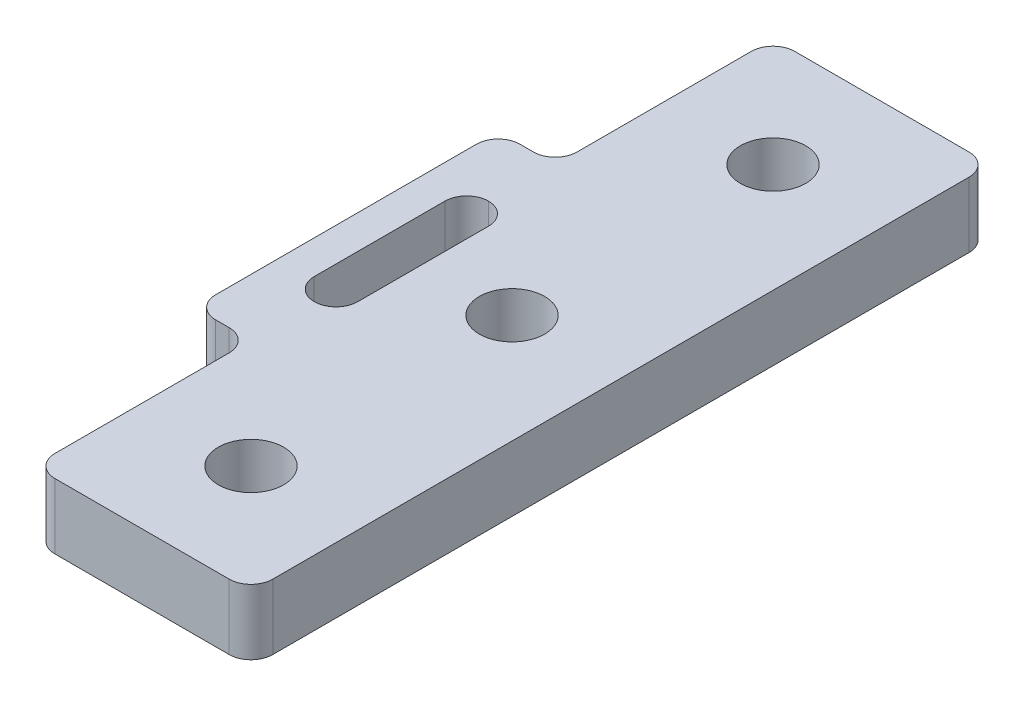
from build123d import *

# Parameters (mm, degrees)
SKETCH2_W           = 10
SKETCH2_H           = 10
SKETCH2_R           = 1.5
SKETCH2_W_2         = 12.62
SKETCH2_H_2         = 13.97
SKETCH2_W_3         = 2
SKETCH2_H_3         = 8
BOSS_EXTRUDE1_DEPTH = 3
FILLET2_R           = 1
FILLET3_R           = 1


with BuildPart() as part:
    # Sketch2 → Boss-Extrude1 (new body)
    # profile 1 of 3: a face of its own
    with BuildSketch(Plane(origin=(0, 0, 0), x_dir=(1, 0, 0), z_dir=(0, 1, 0))):
        with Locations((7.62, -5)):
            Rectangle(SKETCH2_W, SKETCH2_H)
        with Locations(Location((7.62, -5, 0), (0, 0, 270))):
            Circle(SKETCH2_R, mode=Mode.SUBTRACT)
    # profile 2 of 3: a face of its own
    with BuildSketch(Plane(origin=(0, 0, 0), x_dir=(1, 0, 0), z_dir=(0, 1, 0))):
        with Locations((6.31, 6.985)):
            Rectangle(SKETCH2_W_2, SKETCH2_H_2)
        with Locations(Location((7.62, 6.985, 0), (0, 0, 270))):
            Circle(SKETCH2_R, mode=Mode.SUBTRACT)
        with Locations((2.54, 6.985)):
            Rectangle(SKETCH2_W_3, SKETCH2_H_3, mode=Mode.SUBTRACT)
    # profile 3 of 3: a face of its own
    with BuildSketch(Plane(origin=(0, 0, 0), x_dir=(1, 0, 0), z_dir=(0, 1, 0))):
        with Locations((7.62, 18.97)):
            Rectangle(SKETCH2_W, SKETCH2_H)
        with Locations(Location((7.62, 18.97, 0), (0, 0, 270))):
            Circle(SKETCH2_R, mode=Mode.SUBTRACT)
    extrude(amount=BOSS_EXTRUDE1_DEPTH)

    # Fillet2
    fillet2_edges = [part.edges().sort_by_distance(p)[0] for p in [
        (1.54, 1.5, -2.985),
        (3.54, 1.5, -2.985),
        (3.54, 1.5, -10.985),
        (1.54, 1.5, -10.985),
    ]]
    fillet(fillet2_edges, radius=FILLET2_R - 0.0001)  # a hair under: the kernel refuses the full size

    # Fillet3
    fillet3_edges = [part.edges().sort_by_distance(p)[0] for p in [
        (12.62, 1.5, 10),
        (2.62, 1.5, 10),
        (2.62, 1.5, 0),
        (0, 1.5, 0),
        (0, 1.5, -13.97),
        (2.62, 1.5, -13.97),
        (2.62, 1.5, -23.97),
        (12.62, 1.5, -23.97),
    ]]
    fillet(fillet3_edges, radius=FILLET3_R)


solid = part.part
